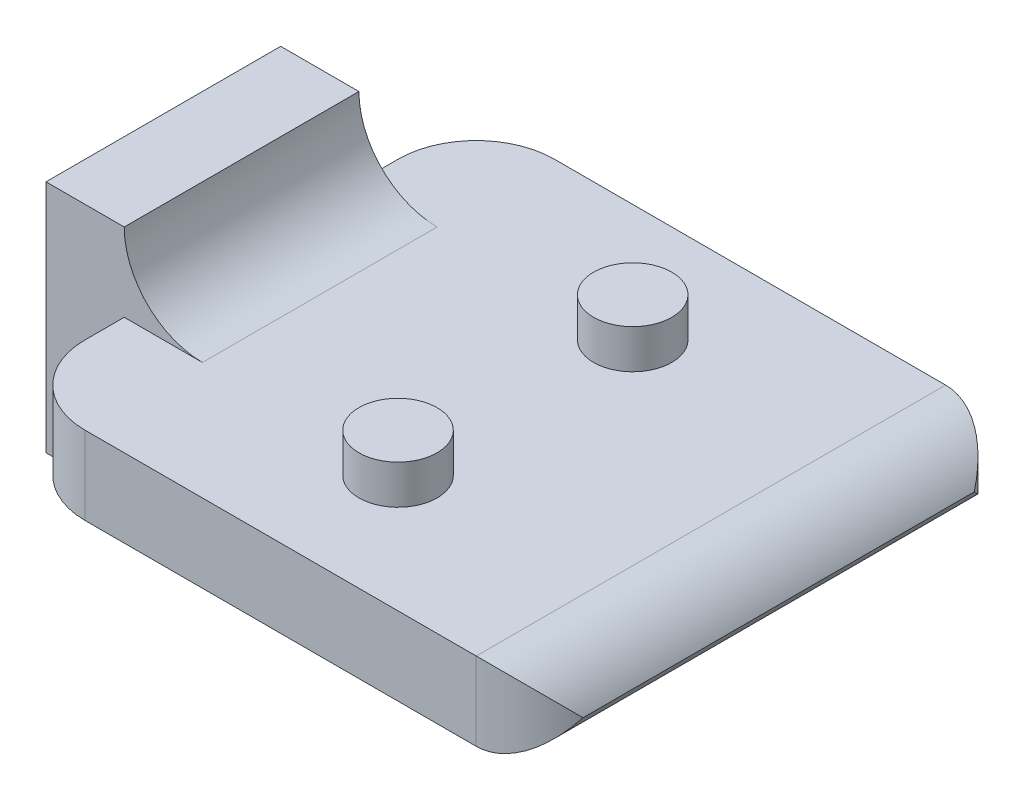
from build123d import *

# Parameters (mm, degrees)
SKETCH1_W                = 10
SKETCH1_H                = 30
SKETCH1_W_2              = 70
SKETCH1_H_2              = 60
BOSS_EXTRUDE1_DEPTH      = 10
BOSS_EXTRUDE2_DEPTH      = 10
BOSS_EXTRUDE2_DEPTH_BACK = 20
SKETCH2_W                = 10
SKETCH2_H                = 30
FILLET1_R                = 10
SKETCH3_R                = 5
BOSS_EXTRUDE3_DEPTH      = 5
SKETCH4_W                = 16.278089822
SKETCH4_H                = 6.399401724
CUT_EXTRUDE1_DEPTH       = 5


with BuildPart() as part:
    # Sketch1 → Boss-Extrude1 (new body)
    with BuildSketch(Plane(origin=(0, 0, 0), x_dir=(1, 0, 0), z_dir=(0, 1, 0))):
        with Locations((-40, 0)):
            Rectangle(SKETCH1_W, SKETCH1_H)
        Rectangle(SKETCH1_W_2, SKETCH1_H_2)
    extrude(amount=BOSS_EXTRUDE1_DEPTH)

    # Sketch2 → Boss-Extrude2 (add, two sides: drawn at the far end of the back side and taken through both)
    with BuildSketch(Plane(origin=(0, 10, 0), x_dir=(1, 0, 0), z_dir=(0, 1, 0)).offset(-BOSS_EXTRUDE2_DEPTH_BACK)):
        with Locations((-40, 0)):
            Rectangle(SKETCH2_W, SKETCH2_H)
    extrude(amount=BOSS_EXTRUDE2_DEPTH + BOSS_EXTRUDE2_DEPTH_BACK)

    # Fillet1
    # the kernel refuses this fillet: 10 mm, written as the material it adds along each edge
    with BuildSketch(Plane(origin=(-35, 0, 15), x_dir=(0, -1, 0), z_dir=(0, 0, -1)), Plane(origin=(-35, 10, 15), x_dir=(1, 0, 0), z_dir=(0, 0, -1))) as fillet1_piece_1:
        with BuildLine():
            CenterArc((FILLET1_R, -FILLET1_R), FILLET1_R, 90, 90)
            Line((0, -FILLET1_R), (0, 0))
            Line((0, 0), (FILLET1_R, 0))
        make_face()
    extrude(amount=30)
    # the kernel refuses this fillet: 10 mm, written as the material it takes off along each edge
    with BuildSketch(Plane(origin=(35, 0, -55), x_dir=(0, 1, 0), z_dir=(0, 0, 1))) as fillet1_2_piece_1:
        with BuildLine():
            CenterArc((FILLET1_R, FILLET1_R), FILLET1_R, 180, 90)
            Line((0, FILLET1_R), (0, 0))
            Line((0, 0), (FILLET1_R, 0))
        make_face()
    extrude(amount=110, mode=Mode.SUBTRACT)
    with BuildSketch(Plane(origin=(-35, -25, -30), x_dir=(1, 0, 0), z_dir=(0, 1, 0)), Plane(origin=(35, -25, -30), x_dir=(0, 0, 1), z_dir=(0, 1, 0))) as fillet1_2_piece_2:
        with BuildLine():
            CenterArc((FILLET1_R, -FILLET1_R), FILLET1_R, 90, 90)
            Line((0, -FILLET1_R), (0, 0))
            Line((0, 0), (FILLET1_R, 0))
        make_face()
    extrude(amount=60, mode=Mode.SUBTRACT)
    with BuildSketch(Plane(origin=(35, -25, 30), x_dir=(0, 0, -1), z_dir=(0, 1, 0)), Plane(origin=(-35, -25, 30), x_dir=(1, 0, 0), z_dir=(0, 1, 0))) as fillet1_2_piece_3:
        with BuildLine():
            CenterArc((FILLET1_R, FILLET1_R), FILLET1_R, 180, 90)
            Line((0, FILLET1_R), (0, 0))
            Line((0, 0), (FILLET1_R, 0))
        make_face()
    extrude(amount=60, mode=Mode.SUBTRACT)
    with BuildSketch(Plane(origin=(35, 10, -55), x_dir=(0, -1, 0), z_dir=(0, 0, 1))) as fillet1_2_piece_4:
        with BuildLine():
            CenterArc((FILLET1_R, -FILLET1_R), FILLET1_R, 90, 90)
            Line((0, -FILLET1_R), (0, 0))
            Line((0, 0), (FILLET1_R, 0))
        make_face()
    extrude(amount=110, mode=Mode.SUBTRACT)

    # Sketch3 → Boss-Extrude3 (add)
    with BuildSketch(Plane(origin=(0, 10, 0), x_dir=(1, 0, 0), z_dir=(0, 1, 0))):
        with Locations(Location((0, 15, 0), (0, 0, 270))):
            Circle(SKETCH3_R)
        with Locations(Location((0, -15, 0), (0, 0, 270))):
            Circle(SKETCH3_R)
    extrude(amount=BOSS_EXTRUDE3_DEPTH)

    # Sketch4 → Cut-Extrude1 (cut)
    with BuildSketch(Plane.ZY.offset(45)):
        with Locations((0, 5)):
            Rectangle(SKETCH4_W, SKETCH4_H)
    extrude(amount=-CUT_EXTRUDE1_DEPTH, mode=Mode.SUBTRACT)


solid = part.part
